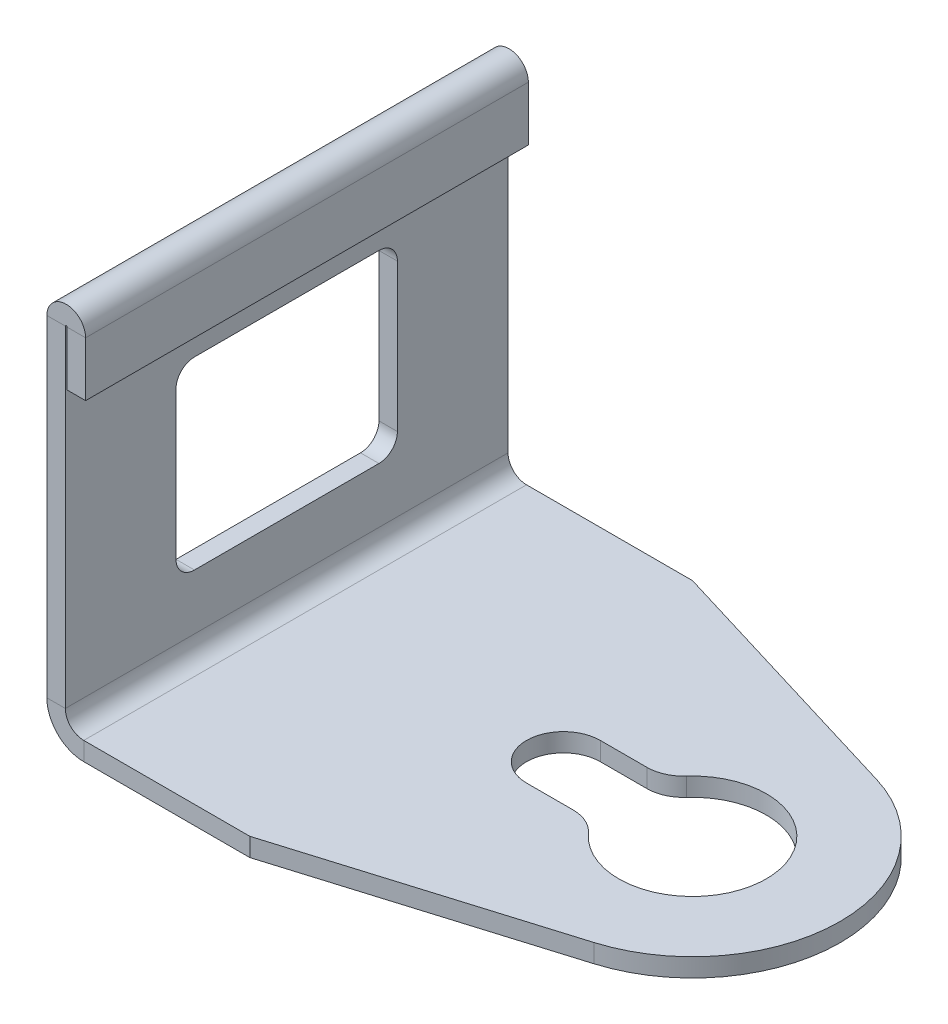
from build123d import *

# Parameters (mm, degrees)
BASE_FLANGE1_DEPTH = 1
EDGE_FLANGE1_DEPTH = 24
HEM1_START         = -12
HEM1_DEPTH         = 24
HEM1_2_DEPTH       = 24
CUT_EXTRUDE1_DEPTH = 10


# Read off the part's stored shape, not the designer's step: Hem1
# Sheet-metal steps are written as plain solids
with BuildPart() as part:
    # Sketch1 → Base-Flange1 (new body)
    with BuildSketch(Plane(origin=(0, 0, 0), x_dir=(1, 0, 0), z_dir=(0, 1, 0))):
        with BuildLine():
            Line((0, 12), (9, 12))
            Line((9, 12), (23.322209849, 7.655543182))
            ThreePointArc((23.322209849, 7.655543182), (29, 0), (23.322209849, -7.655543182))
            Line((23.322209849, -7.655543182), (9, -12))
            Line((9, -12), (0, -12))
            Line((0, -12), (0, 12))
        make_face()
        with BuildLine():
            Line((14, 2), (16.527864045, 2))
            ThreePointArc((16.527864045, 2), (17.344360626, 2.174258142), (18.01857603, 2.666666667))
            ThreePointArc((18.01857603, 2.666666667), (25, 0), (18.01857603, -2.666666667))
            ThreePointArc((18.01857603, -2.666666667), (17.344360626, -2.174258142), (16.527864045, -2))
            Line((16.527864045, -2), (14, -2))
            ThreePointArc((14, -2), (12, 0), (14, 2))
        make_face(mode=Mode.SUBTRACT)
    extrude(amount=-BASE_FLANGE1_DEPTH)

    # Edge-Flange1 section (across the edge) → Edge-Flange1 (add)
    with BuildSketch(Plane(origin=(-1, 0, -12), x_dir=(1, 0, 0), z_dir=(0, 0, 1))):
        with BuildLine():
            Line((-1, 1), (-1, 20))
            Line((-1, 20), (0, 20))
            Line((0, 20), (0, 1))
            ThreePointArc((0, 1), (0.292893219, 0.292893219), (1, 0))
            Line((1, 0), (1, -1))
            ThreePointArc((1, -1), (-0.414213562, -0.414213562), (-1, 1))
        make_face()
    extrude(amount=EDGE_FLANGE1_DEPTH)

    # Hem1 outline → Hem1 (cut)
    with BuildSketch(Plane.XY.offset(HEM1_START)):
        with BuildLine():
            ThreePointArc((-2, 18.95), (-1.709934208, 19.674568837), (-1, 19.998808848))
            Line((-1, 19.998808848), (-1, 20))
            Line((-1, 20), (-2, 20))
            Line((-2, 20), (-2, 18.95))
        make_face()
    extrude(amount=HEM1_DEPTH, mode=Mode.SUBTRACT)

    # Hem1 2 outline → Hem1 2 (add)
    with BuildSketch(Plane.XY.offset(HEM1_START)):
        with BuildLine():
            Line((-0.9, 16), (0.1, 16))
            Line((0.1, 16), (0.1, 18.95))
            ThreePointArc((0.1, 18.95), (-0.225431163, 19.709934208), (-1, 19.998808848))
            Line((-1, 19.998808848), (-1, 18.95))
            ThreePointArc((-1, 18.95), (-0.95, 19), (-0.9, 18.95))
            Line((-0.9, 18.95), (-0.9, 16))
        make_face()
    extrude(amount=HEM1_2_DEPTH)

    # Sketch13 → Cut-Extrude1 (cut)
    with BuildSketch(Plane(origin=(-1, 0, 0), x_dir=(0, 0, -1), z_dir=(1, 0, 0))):
        with BuildLine():
            Line((-5, 14), (5, 14))
            ThreePointArc((5, 14), (5.707106781, 13.707106781), (6, 13))
            Line((6, 13), (6, 5))
            ThreePointArc((6, 5), (5.707106781, 4.292893219), (5, 4))
            Line((5, 4), (-5, 4))
            ThreePointArc((-5, 4), (-5.707106781, 4.292893219), (-6, 5))
            Line((-6, 5), (-6, 13))
            ThreePointArc((-6, 13), (-5.707106781, 13.707106781), (-5, 14))
        make_face()
    extrude(amount=-CUT_EXTRUDE1_DEPTH, mode=Mode.SUBTRACT)


solid = part.part
